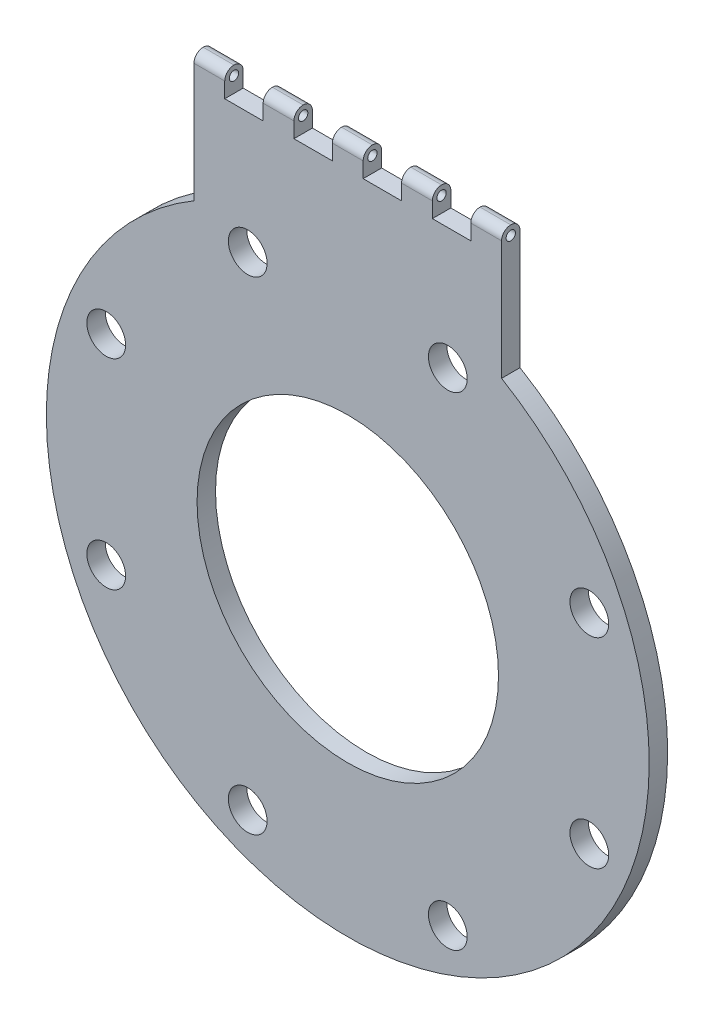
from build123d import *

# Parameters (mm, degrees)
SKETCH1_R                            = 49
BOSS_EXTRUDE1_DEPTH                  = 3
SKETCH2_R                            = 24.5
CUT_EXTRUDE1_DEPTH                   = 3
SKETCH3_R                            = 3.150000005
CUT_EXTRUDE2_DEPTH                   = 3
SKETCH5_W                            = 50
SKETCH5_H                            = 3
BOSS_EXTRUDE3_DEPTH                  = 10
BOSS_EXTRUDE3_DIRECTION_2_REACH      = 111.608
BOSS_EXTRUDE3_DIRECTION_2_END_RADIUS = 49
SKETCH6_W                            = 5
SKETCH6_H                            = 3
BOSS_EXTRUDE4_DEPTH                  = 4
FILLET1_R                            = 1.5
LPATTERN3_COUNT                      = 5
LPATTERN3_PITCH                      = 11.25
FILLET1_OF_LPATTERN3_R               = 1.5
CUT_EXTRUDE3_DEPTH                   = 98.231682079
CUT_EXTRUDE3_DEPTH_BACK              = 98.231682079
SKETCH7_R                            = 0.756640097


with BuildPart() as part:
    # Sketch1 → Boss-Extrude1 (new body)
    with BuildSketch(Plane.XY):
        Circle(SKETCH1_R)
    extrude(amount=BOSS_EXTRUDE1_DEPTH)

    # Sketch2 → Cut-Extrude1 (cut)
    with BuildSketch(Plane.XY.offset(3)):
        Circle(SKETCH2_R)
    extrude(amount=-CUT_EXTRUDE1_DEPTH, mode=Mode.SUBTRACT)

    # Sketch3 → Cut-Extrude2 (cut)
    with BuildSketch(Plane.XY.offset(3)):
        with Locations((16.264045876, -39.264880132)):
            Circle(SKETCH3_R)
        with Locations((39.264880132, -16.264045875)):
            Circle(SKETCH3_R)
        with Locations((39.264880132, 16.264045876)):
            Circle(SKETCH3_R)
        with Locations((16.264045876, 39.264880132)):
            Circle(SKETCH3_R)
        with Locations((-16.264045875, 39.264880132)):
            Circle(SKETCH3_R)
        with Locations((-39.264880132, 16.264045876)):
            Circle(SKETCH3_R)
        with Locations((-39.264880132, -16.264045875)):
            Circle(SKETCH3_R)
        with Locations((-16.264045875, -39.264880132)):
            Circle(SKETCH3_R)
    extrude(amount=-CUT_EXTRUDE2_DEPTH, mode=Mode.SUBTRACT)

    # Sketch5 → Boss-Extrude3 (add)
    with BuildSketch(Plane(origin=(0, 49, 0), x_dir=(1, 0, 0), z_dir=(0, 1, 0))):
        with Locations((0, -1.5)):
            Rectangle(SKETCH5_W, SKETCH5_H)
    extrude(amount=BOSS_EXTRUDE3_DEPTH)

    # Boss-Extrude3 direction 2: up to this cylinder (the profile starts outside it)
    boss_extrude3_direction_2_end = Plane(origin=(0, 0, 1.5), z_dir=(0, 0, -1)) * Cylinder(BOSS_EXTRUDE3_DIRECTION_2_END_RADIUS, 322.216, mode=Mode.PRIVATE)
    # Sketch5 → Boss-Extrude3 direction 2 (add, up to the surface)
    with BuildSketch(Plane(origin=(0, 49, 0), x_dir=(1, 0, 0), z_dir=(0, 1, 0)), mode=Mode.PRIVATE) as boss_extrude3_direction_2_sk1:
        with Locations((0, -1.5)):
            Rectangle(SKETCH5_W, SKETCH5_H)
    boss_extrude3_direction_2_tool1 = extrude(boss_extrude3_direction_2_sk1.sketch, amount=-BOSS_EXTRUDE3_DIRECTION_2_REACH, mode=Mode.PRIVATE) - boss_extrude3_direction_2_end
    add(boss_extrude3_direction_2_tool1.solids().sort_by_distance((0, 49, 1.5))[0])
    add(boss_extrude3_direction_2_tool1.solids().sort_by_distance((0, 49, 1.5))[1])

    # Sketch6 → Boss-Extrude4 (add)
    with BuildSketch(Plane(origin=(0, 59, 0), x_dir=(1, 0, 0), z_dir=(0, 1, 0))):
        with Locations((-22.5, -1.5)):
            Rectangle(SKETCH6_W, SKETCH6_H)
    boss_extrude4 = extrude(amount=BOSS_EXTRUDE4_DEPTH)

    # Fillet1
    fillet1_edges = [part.edges().sort_by_distance(p)[0] for p in [
        (-22.5, 63, 0),
        (-22.5, 63, 3),
    ]]
    fillet(fillet1_edges, radius=FILLET1_R - 0.0001)  # a hair under: the kernel refuses the full size

    # LPattern3: Boss-Extrude4 ×5
    with Locations(*[(i * LPATTERN3_PITCH, 0, 0) for i in range(1, LPATTERN3_COUNT)]):
        add(boss_extrude4)

    # Fillet1 of LPattern3
    fillet1_of_lpattern3_edges = [part.edges().sort_by_distance(p)[0] for p in [
        (-11.25, 63, 0),
        (-11.25, 63, 3),
        (0, 63, 0),
        (0, 63, 3),
        (11.25, 63, 0),
        (11.25, 63, 3),
        (22.5, 63, 0),
        (22.5, 63, 3),
    ]]
    fillet(fillet1_of_lpattern3_edges, radius=FILLET1_OF_LPATTERN3_R - 0.0001)  # a hair under: the kernel refuses the full size

    # Sketch7 → Cut-Extrude3 (cut, two sides: drawn at the far end of the back side and taken through both)
    with BuildSketch(Plane.ZY.offset(25).offset(-CUT_EXTRUDE3_DEPTH_BACK)):
        with Locations(Location((1.5, 61.5, 0), (0, 0, 180))):
            Circle(SKETCH7_R)
    extrude(amount=CUT_EXTRUDE3_DEPTH + CUT_EXTRUDE3_DEPTH_BACK, mode=Mode.SUBTRACT)


solid = part.part
